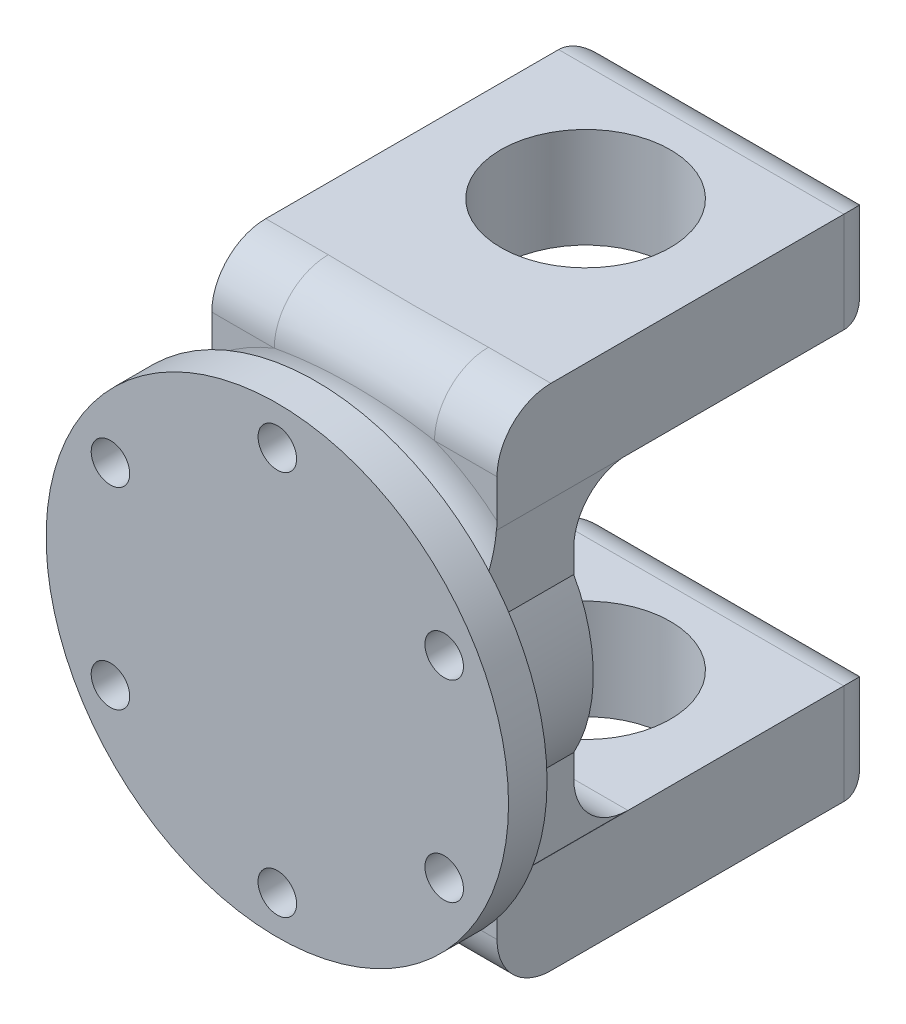
from build123d import *

# Parameters (mm, degrees)
SZKIC1_R                    = 21
DODANIE_WYCI_GNI_CIE1_DEPTH = 15
SZKIC6_R                    = 30
DODANIE_WYCI_GNI_CIE3_DEPTH = 5
SZKIC7_R                    = 2.5
WYTNIJ_WYCI_GNI_CIE2_DEPTH  = 5
SZYK_KO_OWY1_COUNT          = 6
SZKIC8_W                    = 37
SZKIC8_H                    = 13
DODANIE_WYCI_GNI_CIE4_DEPTH = 50
SZKIC9_W                    = 36.932370626
SZKIC9_H                    = 10
DODANIE_WYCI_GNI_CIE5_DEPTH = 10
ZAOKR_GLENIE1_R             = 7
ZAOKR_GLENIE2_R             = 7
SZKIC10_R                   = 11
WYTNIJ_WYCI_GNI_CIE3_DEPTH  = 83.800966306
ZAOKR_GLENIE3_R             = 5


# Read off the part's stored shape, not the designer's step: Lustro1
with BuildPart() as part:
    # Szkic1 → Dodanie-wyciągnięcie1 (new body)
    with BuildSketch(Plane.XY):
        Circle(SZKIC1_R)
    extrude(amount=DODANIE_WYCI_GNI_CIE1_DEPTH)

    # Szkic6 → Dodanie-wyciągnięcie3 (add)
    with BuildSketch(Plane.XY.offset(15)):
        Circle(SZKIC6_R)
    extrude(amount=DODANIE_WYCI_GNI_CIE3_DEPTH)

    # Szkic7 → Wytnij-wyciągnięcie2 (cut)
    with BuildSketch(Plane.XY.offset(20)):
        with Locations((0, 25)):
            Circle(SZKIC7_R)
    wytnij_wyci_gni_cie2 = extrude(amount=-WYTNIJ_WYCI_GNI_CIE2_DEPTH, mode=Mode.SUBTRACT)

    # Szyk kołowy1: Wytnij-wyciągnięcie2 ×6 about axis
    szyk_ko_owy1_axis = Axis((0, 0, 0), (0, 0, 1))
    for i in range(1, SZYK_KO_OWY1_COUNT):
        add(wytnij_wyci_gni_cie2.rotate(szyk_ko_owy1_axis, i * 360 / SZYK_KO_OWY1_COUNT), mode=Mode.SUBTRACT)

    # Szkic8 → Dodanie-wyciągnięcie4 (add)
    with BuildSketch(Plane(origin=(0, 0, -40), x_dir=(-1, 0, 0), z_dir=(0, 0, -1))):
        with Locations((0, 26.5)):
            Rectangle(SZKIC8_W, SZKIC8_H)
    extrude(amount=-DODANIE_WYCI_GNI_CIE4_DEPTH)

    # Szkic9 → Dodanie-wyciągnięcie5 (add)
    with BuildSketch(Plane(origin=(0, 10, 0), x_dir=(1, 0, 0), z_dir=(0, 1, 0))):
        with Locations((0, -5)):
            Rectangle(SZKIC9_W, SZKIC9_H)
    extrude(amount=DODANIE_WYCI_GNI_CIE5_DEPTH)

    # Zaokrąglenie1
    # the kernel refuses this fillet: 7 mm, written as the material it adds along each edge
    with BuildSketch(Plane(origin=(-18.466185313, 20, 0), x_dir=(0, 0, -1), z_dir=(1, 0, 0))) as zaokr_glenie1_piece_1:
        with BuildLine():
            CenterArc((ZAOKR_GLENIE1_R, -ZAOKR_GLENIE1_R), ZAOKR_GLENIE1_R, 90, 90)
            Line((0, -ZAOKR_GLENIE1_R), (0, 0))
            Line((0, 0), (ZAOKR_GLENIE1_R, 0))
        make_face()
    extrude(amount=36.932370625)
    with BuildSketch(Plane(origin=(0, 0, 10), x_dir=(0.9435381877974668, -0.33126377430662773, 0), z_dir=(-0.33126377430662773, -0.9435381877974668, 0))) as zaokr_glenie1_piece_2_section:
        with BuildLine():
            CenterArc((21 + ZAOKR_GLENIE1_R, ZAOKR_GLENIE1_R), ZAOKR_GLENIE1_R, 180, 90)
            Line((21 + ZAOKR_GLENIE1_R, 0), (21, 0))
            Line((21, 0), (21, ZAOKR_GLENIE1_R))
        make_face()
    zaokr_glenie1_piece_2 = revolve(axis=Axis((0, 0, 10), (0, 0, 1)), revolution_arc=218.690998802, mode=Mode.PRIVATE)
    zaokr_glenie1_piece_2 = split(zaokr_glenie1_piece_2, bisect_by=Plane(origin=(18.482842321, 20, 10.012675599), z_dir=(0, 1, 0)), keep=Keep.TOP, mode=Mode.PRIVATE)
    zaokr_glenie1_piece_2 = split(zaokr_glenie1_piece_2, bisect_by=Plane(origin=(18.5, 20.258945845, 10.012675599), z_dir=(-1, 0, 0)), keep=Keep.TOP, mode=Mode.PRIVATE)
    zaokr_glenie1_piece_2 = split(zaokr_glenie1_piece_2, bisect_by=Plane(origin=(-18.5, 20.258945845, 10.012675599), z_dir=(1, 0, 0)), keep=Keep.TOP, mode=Mode.PRIVATE)
    add(zaokr_glenie1_piece_2)
    with BuildSketch(Plane(origin=(0, 0, 10), x_dir=(0.9435381877974668, -0.33126377430662773, 0), z_dir=(-0.33126377430662773, -0.9435381877974668, 0))) as zaokr_glenie1_piece_3_section:
        with BuildLine():
            CenterArc((21 + ZAOKR_GLENIE1_R, ZAOKR_GLENIE1_R), ZAOKR_GLENIE1_R, 180, 90)
            Line((21 + ZAOKR_GLENIE1_R, 0), (21, 0))
            Line((21, 0), (21, ZAOKR_GLENIE1_R))
        make_face()
    zaokr_glenie1_piece_3 = revolve(axis=Axis((0, 0, 10), (0, 0, 1)), revolution_arc=218.690998802, mode=Mode.PRIVATE)
    zaokr_glenie1_piece_3 = split(zaokr_glenie1_piece_3, bisect_by=Plane(origin=(18.466185313, 16.543061686, 11.724606468), z_dir=(-1, 0, 0)), keep=Keep.TOP, mode=Mode.PRIVATE)
    zaokr_glenie1_piece_3 = split(zaokr_glenie1_piece_3, bisect_by=Plane(origin=(-18.466185313, 16.543061686, 11.724606468), z_dir=(1, 0, 0)), keep=Keep.TOP, mode=Mode.PRIVATE)
    add(zaokr_glenie1_piece_3)

    # Zaokrąglenie2
    zaokr_glenie2_edges = [part.edges().sort_by_distance(p)[0] for p in [
        (0, 33, 10),
    ]]
    fillet(zaokr_glenie2_edges, radius=ZAOKR_GLENIE2_R)

    # Lustro1: part across plane


with BuildPart() as part_1:
    add(part.part)
    add(part.part.mirror(Plane.ZX))

    # Szkic10 → Wytnij-wyciągnięcie3 (cut, through all)
    with BuildSketch(Plane(origin=(0, 33, 0), x_dir=(1, 0, 0), z_dir=(0, 1, 0))):
        with Locations(Location((0, 20, 0), (0, 0, 180))):
            Circle(SZKIC10_R)
    extrude(amount=-WYTNIJ_WYCI_GNI_CIE3_DEPTH, mode=Mode.SUBTRACT)

    # Zaokrąglenie3
    zaokr_glenie3_edges = [part_1.edges().sort_by_distance(p)[0] for p in [
        (0, -20, -40),
        (18.5, -26.5, -40),
        (0, -33, -40),
        (-18.5, -26.5, -40),
        (0, 33, -40),
        (-18.5, 26.5, -40),
        (18.5, 26.5, -40),
        (0, 20, -40),
    ]]
    fillet(zaokr_glenie3_edges, radius=ZAOKR_GLENIE3_R)


solid = part_1.part
